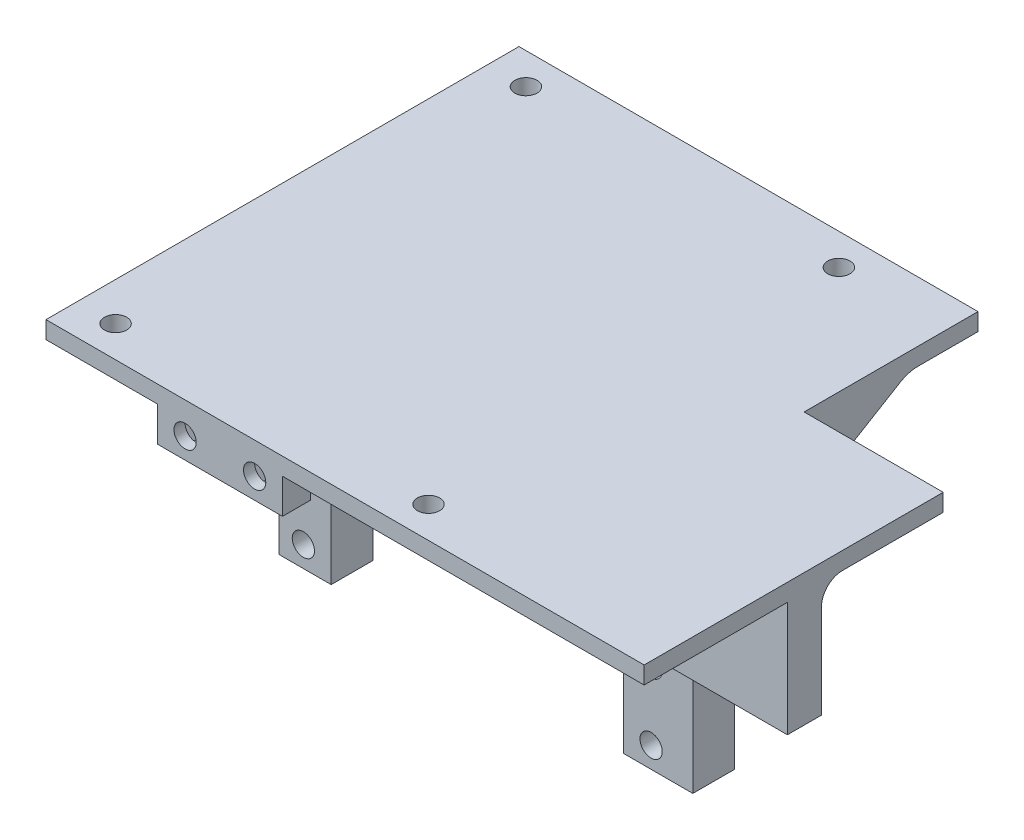
from build123d import *

# Parameters (mm, degrees)
ORTHOGONAL_START                              = -15
ORTHOGONAL_CHASSIS_PLATE_PRIMARY_PROFILE_W    = 66
ORTHOGONAL_CHASSIS_PLATE_PRIMARY_PROFILE_H    = 4
ORTHOGONAL_CHASSIS_PLATE_PRIMARY_DEPTH        = 25.1
ORTHOGONAL_START_2                            = 10
ORTHOGONAL_CHASSIS_PLATE_GUIDE_SIDE_PROF_W    = 109
ORTHOGONAL_CHASSIS_PLATE_GUIDE_SIDE_PROF_H    = 4
ORTHOGONAL_CHASSIS_PLATE_GUIDE_SIDE_DEPTH     = 43
HORIZONTAL_START                              = 20
HORIZONTAL_SERVO_SEAT_UPRIGHTS_PROFILE_W      = 7.5
HORIZONTAL_SERVO_SEAT_UPRIGHTS_PROFILE_H      = 37.1
HORIZONTAL_SERVO_SEAT_UPRIGHTS_PROFILE_W_2    = 10
HORIZONTAL_SERVO_SEAT_UPRIGHTS_DEPTH          = 6
SIDE_START                                    = 27.5
SIDE_MOUNTING_FACE_FOR_MGN7_RAIL_PROFILE_W    = 100
SIDE_MOUNTING_FACE_FOR_MGN7_RAIL_PROFILE_H    = 16.6
SIDE_MOUNTING_FACE_FOR_MGN7_RAIL_DEPTH        = 4.9
HORIZONTAL_START_2                            = 49
HORIZONTAL_LIMIT_BRACKET_FOOT_SUPPORT_PR_W    = 18
HORIZONTAL_LIMIT_BRACKET_FOOT_SUPPORT_PR_H    = 5.1
HORIZONTAL_LIMIT_BRACKET_FOOT_SUPPORT_DEPTH   = 4
CHASSIS_START                                 = 28.9
CHASSIS_MOUNTING_HOLE_LAYOUT_45_X_41_2_R      = 1.6
CHASSIS_MOUNTING_HOLE_LAYOUT_45_X_41_MM_DEPTH = 4.2
SERVO_START                                   = 19.9
SERVO_MOUNT_50_X_10_MM_PITCH_PROFILE_R        = 1.6
SERVO_MOUNT_50_X_10_MM_PITCH_DEPTH            = 6.2
GUIDE_START                                   = 27.45
GUIDE_M2_MOUNTING_PILOTS_15_MM_PITCH_PRO_R    = 1.05
GUIDE_M2_MOUNTING_PILOTS_15_MM_PITCH_DEPTH    = 5.05
STOP_START                                    = 48.9
STOP_MOUNTING_TWO_M3_PILOTS_10_MM_PI_2_R      = 1.6
STOP_MOUNTING_TWO_M3_PILOTS_10_MM_PITCH_DEPTH = 4.2
FILLET_2_R                                    = 3
SKETCH_3_W                                    = 18
SKETCH_3_H                                    = 3
CUT_EXTRUDE_1_DEPTH                           = 2
CUT_EXTRUDE_2_DEPTH                           = 2.4
EXTRUDE_3_DEPTH                               = 7.5
EXTRUDE_4_DEPTH                               = 10
FILLET_3_R                                    = 5
SKETCH_7_W                                    = 109
SKETCH_7_H                                    = 1.5
CUT_EXTRUDE_3_DEPTH                           = 80
SKETCH_8_W                                    = 23
SKETCH_8_H                                    = 43
CUT_EXTRUDE_4_DEPTH                           = 30


with BuildPart() as part:
    # Orthogonal chassis plate primary profile → Orthogonal chassis plate primary (new body)
    with BuildSketch(Plane.XY.offset(ORTHOGONAL_START)):
        with Locations((8, 31)):
            Rectangle(ORTHOGONAL_CHASSIS_PLATE_PRIMARY_PROFILE_W, ORTHOGONAL_CHASSIS_PLATE_PRIMARY_PROFILE_H)
    extrude(amount=ORTHOGONAL_CHASSIS_PLATE_PRIMARY_DEPTH)

    # Orthogonal chassis plate guide side profile → Orthogonal chassis plate guide side (add)
    with BuildSketch(Plane.XY.offset(ORTHOGONAL_START_2)):
        with Locations((29.5, 31)):
            Rectangle(ORTHOGONAL_CHASSIS_PLATE_GUIDE_SIDE_PROF_W, ORTHOGONAL_CHASSIS_PLATE_GUIDE_SIDE_PROF_H)
    extrude(amount=ORTHOGONAL_CHASSIS_PLATE_GUIDE_SIDE_DEPTH)

    # Horizontal servo seat uprights profile → Horizontal servo seat uprights (add)
    with BuildSketch(Plane.XY.offset(HORIZONTAL_START)):
        with Locations((-14.75, 10.55)):
            Rectangle(HORIZONTAL_SERVO_SEAT_UPRIGHTS_PROFILE_W, HORIZONTAL_SERVO_SEAT_UPRIGHTS_PROFILE_H)
        with Locations((36, 10.55)):
            Rectangle(HORIZONTAL_SERVO_SEAT_UPRIGHTS_PROFILE_W_2, HORIZONTAL_SERVO_SEAT_UPRIGHTS_PROFILE_H)
    extrude(amount=HORIZONTAL_SERVO_SEAT_UPRIGHTS_DEPTH)

    # Side mounting face for MGN7 rail profile → Side mounting face for MGN7 rail (add)
    with BuildSketch(Plane.XY.offset(SIDE_START)):
        with Locations((33, 20.8)):
            Rectangle(SIDE_MOUNTING_FACE_FOR_MGN7_RAIL_PROFILE_W, SIDE_MOUNTING_FACE_FOR_MGN7_RAIL_PROFILE_H)
    extrude(amount=SIDE_MOUNTING_FACE_FOR_MGN7_RAIL_DEPTH)

    # Horizontal limit bracket foot support profile → Horizontal limit bracket foot support (add)
    with BuildSketch(Plane.XY.offset(HORIZONTAL_START_2)):
        with Locations((0, 26.55)):
            Rectangle(HORIZONTAL_LIMIT_BRACKET_FOOT_SUPPORT_PR_W, HORIZONTAL_LIMIT_BRACKET_FOOT_SUPPORT_PR_H)
    extrude(amount=HORIZONTAL_LIMIT_BRACKET_FOOT_SUPPORT_DEPTH)

    # Chassis mounting hole layout 45 x 41 2 → Chassis mounting hole layout 45 x 41 mm (cut)
    with BuildSketch(Plane(origin=(0, 0, 0), x_dir=(1, 0, 0), z_dir=(0, 1, 0)).offset(CHASSIS_START)):
        with Locations(Location((-19.5, 10.5, 0), (0, 0, 90))):
            Circle(CHASSIS_MOUNTING_HOLE_LAYOUT_45_X_41_2_R)
        with Locations(Location((-19.5, -48.5, 0), (0, 0, 90))):
            Circle(CHASSIS_MOUNTING_HOLE_LAYOUT_45_X_41_2_R)
        with Locations(Location((25.5, 10.5, 0), (0, 0, 90))):
            Circle(CHASSIS_MOUNTING_HOLE_LAYOUT_45_X_41_2_R)
        with Locations(Location((25.5, -48.5, 0), (0, 0, 90))):
            Circle(CHASSIS_MOUNTING_HOLE_LAYOUT_45_X_41_2_R)
        with Locations(Location((70.5, -48.5, 0), (0, 0, 90))):
            Circle(CHASSIS_MOUNTING_HOLE_LAYOUT_45_X_41_2_R)
    extrude(amount=CHASSIS_MOUNTING_HOLE_LAYOUT_45_X_41_MM_DEPTH, mode=Mode.SUBTRACT)

    # Servo mount 50 x 10 mm pitch profile → Servo mount 50 x 10 mm pitch (cut)
    with BuildSketch(Plane.XY.offset(SERVO_START)):
        with Locations(Location((-15, -5, 0), (0, 0, 180))):
            Circle(SERVO_MOUNT_50_X_10_MM_PITCH_PROFILE_R)
        with Locations(Location((-15, 5, 0), (0, 0, 180))):
            Circle(SERVO_MOUNT_50_X_10_MM_PITCH_PROFILE_R)
        with Locations(Location((35, -5, 0), (0, 0, 180))):
            Circle(SERVO_MOUNT_50_X_10_MM_PITCH_PROFILE_R)
        with Locations(Location((35, 5, 0), (0, 0, 180))):
            Circle(SERVO_MOUNT_50_X_10_MM_PITCH_PROFILE_R)
    extrude(amount=SERVO_MOUNT_50_X_10_MM_PITCH_DEPTH, mode=Mode.SUBTRACT)

    # Guide M2 mounting pilots 15 mm pitch profile → Guide M2 mounting pilots 15 mm pitch (cut)
    with BuildSketch(Plane.XY.offset(GUIDE_START)):
        with Locations((-12, 19)):
            Circle(GUIDE_M2_MOUNTING_PILOTS_15_MM_PITCH_PRO_R)
        with Locations((3, 19)):
            Circle(GUIDE_M2_MOUNTING_PILOTS_15_MM_PITCH_PRO_R)
        with Locations((18, 19)):
            Circle(GUIDE_M2_MOUNTING_PILOTS_15_MM_PITCH_PRO_R)
        with Locations((33, 19)):
            Circle(GUIDE_M2_MOUNTING_PILOTS_15_MM_PITCH_PRO_R)
        with Locations((48, 19)):
            Circle(GUIDE_M2_MOUNTING_PILOTS_15_MM_PITCH_PRO_R)
        with Locations((63, 19)):
            Circle(GUIDE_M2_MOUNTING_PILOTS_15_MM_PITCH_PRO_R)
        with Locations((78, 19)):
            Circle(GUIDE_M2_MOUNTING_PILOTS_15_MM_PITCH_PRO_R)
    extrude(amount=GUIDE_M2_MOUNTING_PILOTS_15_MM_PITCH_DEPTH, mode=Mode.SUBTRACT)

    # Stop mounting two M3 pilots 10 mm pi 2 → Stop mounting two M3 pilots 10 mm pitch (cut)
    with BuildSketch(Plane.XY.offset(STOP_START)):
        with Locations((-5, 27)):
            Circle(STOP_MOUNTING_TWO_M3_PILOTS_10_MM_PI_2_R)
        with Locations((5, 27)):
            Circle(STOP_MOUNTING_TWO_M3_PILOTS_10_MM_PI_2_R)
    extrude(amount=STOP_MOUNTING_TWO_M3_PILOTS_10_MM_PITCH_DEPTH, mode=Mode.SUBTRACT)

    # 圆角2
    # the kernel refuses this fillet: 3 mm, written as the material it adds along each edge
    with BuildSketch(Plane(origin=(-17, 29, 27.5), x_dir=(0, 0, -1), z_dir=(1, 0, 0))) as fillet_2_piece_1:
        with BuildLine():
            CenterArc((FILLET_2_R, -FILLET_2_R), FILLET_2_R, 90, 90)
            Line((0, -FILLET_2_R), (0, 0))
            Line((0, 0), (FILLET_2_R, 0))
        make_face()
    extrude(amount=100)

    # 草图3 → 切除-拉伸1 (cut)
    with BuildSketch(Plane(origin=(0, 29, 0), x_dir=(-1, 0, 0), z_dir=(0, -1, 0))):
        with Locations((0, -47.5)):
            Rectangle(SKETCH_3_W, SKETCH_3_H)
    extrude(amount=-CUT_EXTRUDE_1_DEPTH, mode=Mode.SUBTRACT)

    # 草图4 → 切除-拉伸2 (cut)
    with BuildSketch(Plane(origin=(0, 0, 49), x_dir=(-1, 0, 0), z_dir=(0, 0, -1))):
        Polygon((-3.267949192, 30), (-6.732050808, 30), (-8.464101615, 27), (-6.732050808, 24), (-3.267949192, 24), (-1.535898385, 27), align=None)
        Polygon((6.732050808, 30), (3.267949192, 30), (1.535898385, 27), (3.267949192, 24), (6.732050808, 24), (8.464101615, 27), align=None)
    extrude(amount=-CUT_EXTRUDE_2_DEPTH, mode=Mode.SUBTRACT)

    # 草图5 → 凸台-拉伸3 (add)
    with BuildSketch(Plane(origin=(-11, 0, 0), x_dir=(0, 0, -1), z_dir=(1, 0, 0))):
        Polygon((-20, 29), (5, 29), (-20, 14), align=None)
    extrude(amount=-EXTRUDE_3_DEPTH)

    # 草图6 → 凸台-拉伸4 (add)
    with BuildSketch(Plane.ZY.offset(-31)):
        Polygon((20, 29), (-5, 29), (20, 14), align=None)
    extrude(amount=-EXTRUDE_4_DEPTH)

    # 圆角3
    fillet_3_edges = [part.edges().sort_by_distance(p)[0] for p in [
        (-14.75, 14, 20),
        (-14.75, 29, -5),
        (36, 14, 20),
        (36, 29, -5),
    ]]
    fillet(fillet_3_edges, radius=FILLET_3_R)

    # 草图7 → 切除-拉伸3 (cut)
    with BuildSketch(Plane.XY.offset(53)):
        with Locations((29.5, 32.25)):
            Rectangle(SKETCH_7_W, SKETCH_7_H)
    extrude(amount=-CUT_EXTRUDE_3_DEPTH, mode=Mode.SUBTRACT)

    # 草图8 → 切除-拉伸4 (cut)
    with BuildSketch(Plane(origin=(0, 31.5, 0), x_dir=(1, 0, 0), z_dir=(0, 1, 0))):
        with Locations((72.5, -31.5)):
            Rectangle(SKETCH_8_W, SKETCH_8_H)
    extrude(amount=-CUT_EXTRUDE_4_DEPTH, mode=Mode.SUBTRACT)


solid = part.part
